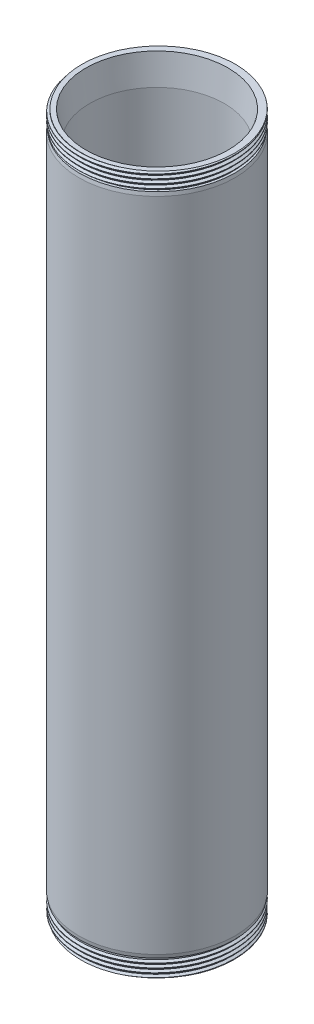
from build123d import *
from build123d.topology import SkipClean

# Parameters (mm, degrees)
FILETAGE1_PITCH = 3.5
FILETAGE1_FROM  = 4
FILETAGE1_TO    = 16
FILETAGE2_PITCH = 3.5
FILETAGE2_TO    = 14


with BuildPart() as part:
    # Esquisse1 → Révolution1 (revolve)
    with BuildSketch(Plane.XY, mode=Mode.PRIVATE) as r_volution1_sk:
        Polygon((56, 266), (59.159659942, 290), (63, 290), (63, 278), (62.5, 278), (62.5, 276), (63, 276), (64.5, 276), (65, 273), (65, 267), (65, -267), (65, -273), (64.5, -276), (63, -276), (63, -290), (59.159659942, -290), (56, -266), align=None)
    revolve(r_volution1_sk.sketch.rotate(Axis((0, 0, 0), (0, 1, 0)), 90), axis=Axis((0, 0, 0), (0, 1, 0)))

    # Filetage1: arcs per turn and ends read off the stored shape
    # Filetage1: the profile of Profil de filetage1 profile screwed along a right-hand helix through 5.714286 turns, 12 arcs to a turn; built about Z, then put on its axis
    filetage1_z = Axis((0, 0, 0), (0, 0, 1))
    filetage1_corners = [(62.9997, 0, -0.000173205), (64.894430562, 0, 1.093749995), (64.894430562, 0, 1.531249995), (62.9997, 0, 2.625173196)]
    with BuildLine(mode=Mode.PRIVATE) as filetage1_profile:
        Line(filetage1_corners[0], filetage1_corners[1])
        Line(filetage1_corners[1], filetage1_corners[2])
        Line(filetage1_corners[2], filetage1_corners[3])
        Line(filetage1_corners[3], filetage1_corners[0])
    filetage1_cap = Face(filetage1_profile.wire())
    filetage1_turn_angles = [0, 15, 30, 45, 60, 75, 90, 105, 120, 135, 150, 165, 180, 195, 210, 225, 240, 255, 270, 285, 300, 315, 330, 345, 360]
    filetage1_turn_weights = [1, 0.9659258262890683, 1, 0.9659258262890683, 1, 0.9659258262890683, 1, 0.9659258262890683, 1, 0.9659258262890683, 1, 0.9659258262890683, 1, 0.9659258262890683, 1, 0.9659258262890683, 1, 0.9659258262890683, 1, 0.9659258262890683, 1, 0.9659258262890683, 1, 0.9659258262890683, 1]
    filetage1_turn_rails = [Edge.make_bspline([Vector(p[0], p[1], 0).rotate(filetage1_z, filetage1_turn_angles[k]) / filetage1_turn_weights[k] + Vector(0, 0, p[2] + FILETAGE1_PITCH * filetage1_turn_angles[k] / 360) for k in range(25)], [0, 0, 0, 1, 1, 2, 2, 3, 3, 4, 4, 5, 5, 6, 6, 7, 7, 8, 8, 9, 9, 10, 10, 11, 11, 12, 12, 12], 2, filetage1_turn_weights) for p in filetage1_corners]
    filetage1_turn_sides = [Face.make_surface_from_curves(filetage1_turn_rails[p[0]], filetage1_turn_rails[p[1]]) for p in [(0, 1), (1, 2), (2, 3), (3, 0)]]
    filetage1_turn = Solid(Shell([*filetage1_turn_sides, filetage1_cap, filetage1_cap.rotate(filetage1_z, 360).moved(Location((0, 0, FILETAGE1_PITCH * 360 / 360)))]))
    filetage1_last_angles = [1800, 1815, 1830, 1845, 1860, 1875, 1890, 1905, 1920, 1935, 1950, 1965, 1980, 1995, 2010, 2025, 2040, 2048.571428571, 2057.142857143]
    filetage1_last_weights = [1, 0.9659258262890683, 1, 0.9659258262890683, 1, 0.9659258262890683, 1, 0.9659258262890683, 1, 0.9659258262890683, 1, 0.9659258262890683, 1, 0.9659258262890683, 1, 0.9659258262890683, 1, 0.9888308262251289, 1]
    filetage1_last_rails = [Edge.make_bspline([Vector(p[0], p[1], 0).rotate(filetage1_z, filetage1_last_angles[k]) / filetage1_last_weights[k] + Vector(0, 0, p[2] + FILETAGE1_PITCH * filetage1_last_angles[k] / 360) for k in range(19)], [0, 0, 0, 1, 1, 2, 2, 3, 3, 4, 4, 5, 5, 6, 6, 7, 7, 8, 8, 9, 9, 9], 2, filetage1_last_weights) for p in filetage1_corners]
    filetage1_last_sides = [Face.make_surface_from_curves(filetage1_last_rails[p[0]], filetage1_last_rails[p[1]]) for p in [(0, 1), (1, 2), (2, 3), (3, 0)]]
    filetage1_last = Solid(Shell([*filetage1_last_sides, filetage1_cap.rotate(filetage1_z, 1800).moved(Location((0, 0, FILETAGE1_PITCH * 1800 / 360))), filetage1_cap.rotate(filetage1_z, 2057.142857143).moved(Location((0, 0, FILETAGE1_PITCH * 2057.142857143 / 360)))]))
    filetage1_each = [*[filetage1_turn.moved(Location((0, 0, FILETAGE1_PITCH * i))) for i in range(5)], filetage1_last]
    add(Plane(origin=(0, 274, 0), x_dir=(1, 0, 0), z_dir=(0, 1, 0)) * split(split(Compound([filetage1_each[i] for i in range(0, 6, 2)]), bisect_by=Plane.XY.offset(FILETAGE1_FROM), keep=Keep.TOP, mode=Mode.PRIVATE), bisect_by=Plane.XY.offset(FILETAGE1_TO), keep=Keep.BOTTOM, mode=Mode.PRIVATE))
    add(Plane(origin=(0, 274, 0), x_dir=(1, 0, 0), z_dir=(0, 1, 0)) * split(split(Compound([filetage1_each[i] for i in range(1, 6, 2)]), bisect_by=Plane.XY.offset(FILETAGE1_FROM), keep=Keep.TOP, mode=Mode.PRIVATE), bisect_by=Plane.XY.offset(FILETAGE1_TO), keep=Keep.BOTTOM, mode=Mode.PRIVATE))

    # Filetage2: arcs per turn and ends read off the stored shape
    # Filetage2: the profile of Profil de filetage2 profile screwed along a right-hand helix through 5.714286 turns, 12 arcs to a turn; built about Z, then put on its axis
    with SkipClean():  # the faces are left unmerged after this step: merging them gives an invalid solid
        filetage2_z = Axis((0, 0, 0), (0, 0, 1))
        filetage2_corners = [(62.9997, 0, -0.000173205), (64.894430563, 0, 1.093749995), (64.894430563, 0, 1.531249995), (62.9997, 0, 2.625173196)]
        with BuildLine(mode=Mode.PRIVATE) as filetage2_profile:
            Line(filetage2_corners[0], filetage2_corners[1])
            Line(filetage2_corners[1], filetage2_corners[2])
            Line(filetage2_corners[2], filetage2_corners[3])
            Line(filetage2_corners[3], filetage2_corners[0])
        filetage2_cap = Face(filetage2_profile.wire())
        filetage2_turn_angles = [0, 15, 30, 45, 60, 75, 90, 105, 120, 135, 150, 165, 180, 195, 210, 225, 240, 255, 270, 285, 300, 315, 330, 345, 360]
        filetage2_turn_weights = [1, 0.9659258262890683, 1, 0.9659258262890683, 1, 0.9659258262890683, 1, 0.9659258262890683, 1, 0.9659258262890683, 1, 0.9659258262890683, 1, 0.9659258262890683, 1, 0.9659258262890683, 1, 0.9659258262890683, 1, 0.9659258262890683, 1, 0.9659258262890683, 1, 0.9659258262890683, 1]
        filetage2_turn_rails = [Edge.make_bspline([Vector(p[0], p[1], 0).rotate(filetage2_z, filetage2_turn_angles[k]) / filetage2_turn_weights[k] + Vector(0, 0, p[2] + FILETAGE2_PITCH * filetage2_turn_angles[k] / 360) for k in range(25)], [0, 0, 0, 1, 1, 2, 2, 3, 3, 4, 4, 5, 5, 6, 6, 7, 7, 8, 8, 9, 9, 10, 10, 11, 11, 12, 12, 12], 2, filetage2_turn_weights) for p in filetage2_corners]
        filetage2_turn_sides = [Face.make_surface_from_curves(filetage2_turn_rails[p[0]], filetage2_turn_rails[p[1]]) for p in [(0, 1), (1, 2), (2, 3), (3, 0)]]
        filetage2_last_angles = [1800, 1815, 1830, 1845, 1860, 1875, 1890, 1905, 1920, 1935, 1950, 1965, 1980, 1995, 2010, 2025, 2040, 2048.571428571, 2057.142857143]
        filetage2_last_weights = [1, 0.9659258262890683, 1, 0.9659258262890683, 1, 0.9659258262890683, 1, 0.9659258262890683, 1, 0.9659258262890683, 1, 0.9659258262890683, 1, 0.9659258262890683, 1, 0.9659258262890683, 1, 0.9888308262251289, 1]
        filetage2_last_rails = [Edge.make_bspline([Vector(p[0], p[1], 0).rotate(filetage2_z, filetage2_last_angles[k]) / filetage2_last_weights[k] + Vector(0, 0, p[2] + FILETAGE2_PITCH * filetage2_last_angles[k] / 360) for k in range(19)], [0, 0, 0, 1, 1, 2, 2, 3, 3, 4, 4, 5, 5, 6, 6, 7, 7, 8, 8, 9, 9, 9], 2, filetage2_last_weights) for p in filetage2_corners]
        filetage2_last_sides = [Face.make_surface_from_curves(filetage2_last_rails[p[0]], filetage2_last_rails[p[1]]) for p in [(0, 1), (1, 2), (2, 3), (3, 0)]]
        filetage2 = Plane(origin=(0, -276, 0), x_dir=(-1, 0, 0), z_dir=(0, -1, 0)) * split(Solid(Shell([*[p.moved(Location((0, 0, FILETAGE2_PITCH * i))) for i in range(5) for p in filetage2_turn_sides], *filetage2_last_sides, filetage2_cap, filetage2_cap.rotate(filetage2_z, 2057.142857143).moved(Location((0, 0, FILETAGE2_PITCH * 2057.142857143 / 360)))])), bisect_by=Plane.XY.offset(FILETAGE2_TO), keep=Keep.BOTTOM, mode=Mode.PRIVATE)
        add(filetage2)


solid = part.part
